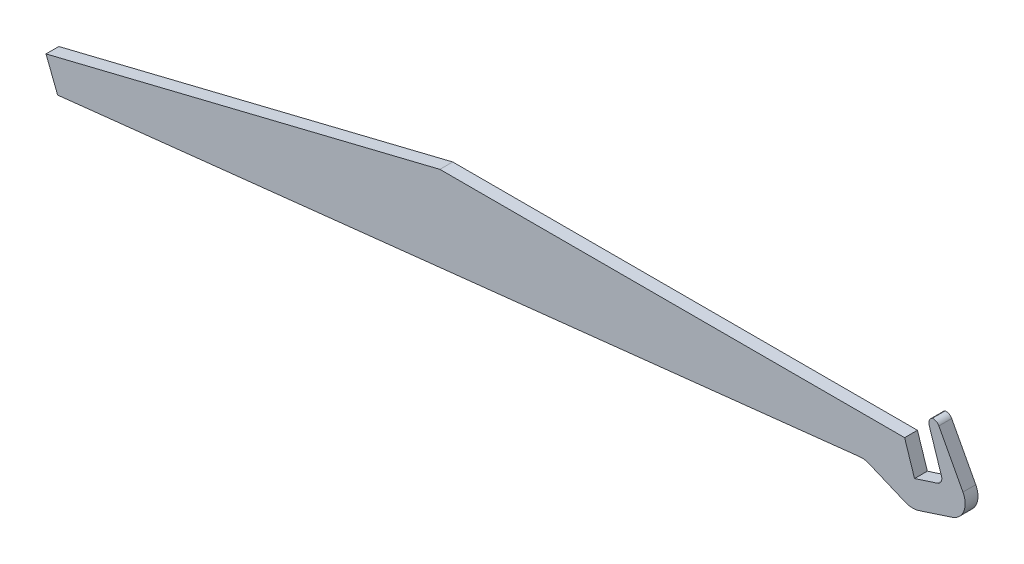
from build123d import *

# Parameters (mm, degrees)
BOSS_EXTRUDE1_DEPTH = 4
FILLET1_R           = 2
FILLET2_R           = 6


with BuildPart() as part:
    # Sketch1 → Boss-Extrude1 (new body)
    with BuildSketch(Plane.XY):
        Polygon((0, 0), (145, 0), (148.090169944, -9.510565163), (157.125206849, -6.574903716), (152.040911292, 9.072949017), (154.894080841, 10), (166.551226371, -11.92390211), (147.252212567, -18.194531813), (132.5, -12), (0, -26.511110048), (-119.286760587, -39.57513503), (-122.91114097, -30.255056337), align=None)
    extrude(amount=BOSS_EXTRUDE1_DEPTH)

    # Fillet1
    # the kernel refuses this fillet: 2 mm, written as the material it adds along each edge
    with BuildSketch(Plane(origin=(157.125206849, -6.574903716, 0), x_dir=(-0.3090169943749429, 0.951056516295155, 0), z_dir=(0, 0, 1))) as fillet1_piece_1:
        with BuildLine():
            CenterArc((FILLET1_R, FILLET1_R), FILLET1_R, 180, 90)
            Line((0, FILLET1_R), (0, 0))
            Line((0, 0), (FILLET1_R, 0))
        make_face()
    extrude(amount=4)
    # the kernel refuses this fillet: 2 mm, written as the material it takes off along each edge
    with BuildSketch(Plane(origin=(152.040911292, 9.072949017, -5), x_dir=(0.3090169943749437, -0.9510565162951549, 0), z_dir=(0, 0, 1))) as fillet1_2_piece_1:
        with BuildLine():
            CenterArc((FILLET1_R, FILLET1_R), FILLET1_R, 180, 90)
            Line((0, FILLET1_R), (0, 0))
            Line((0, 0), (FILLET1_R, 0))
        make_face()
    extrude(amount=14, mode=Mode.SUBTRACT)
    with BuildSketch(Plane(origin=(154.894080841, 10, -4.195498156), x_dir=(-0.9510565162951539, -0.3090169943749466, 0), z_dir=(0, 0, 1))) as fillet1_2_piece_2:
        with BuildLine():
            CenterArc((FILLET1_R * 0.839099631177, FILLET1_R), FILLET1_R, 190, 80)
            Line((-FILLET1_R * 0.145708121835, FILLET1_R * 0.826351822333), (0, 0))
            Line((0, 0), (FILLET1_R * 0.839099631177, 0))
        make_face()
    extrude(amount=12.390996312, mode=Mode.SUBTRACT)

    # Fillet2
    fillet2_edges = [part.edges().sort_by_distance(p)[0] for p in [
        (166.551226371, -11.92390211, 2),
        (147.252212567, -18.194531813, 2),
        (132.5, -12, 2),
    ]]
    fillet(fillet2_edges, radius=FILLET2_R)


solid = part.part
